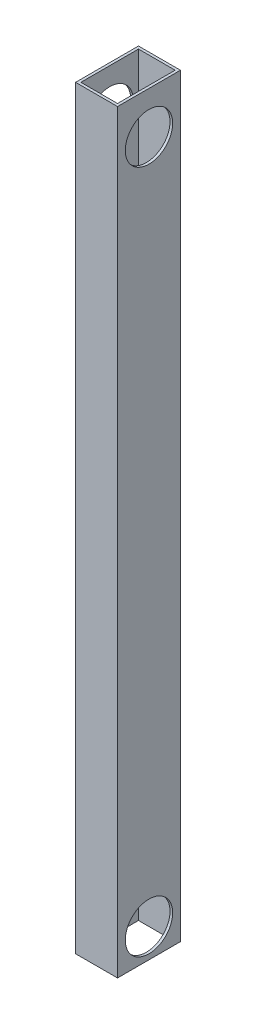
from build123d import *

# Parameters (mm, degrees)
SKETCH1_W               = 25.4
SKETCH1_H               = 38.1
SKETCH1_W_2             = 22.225
SKETCH1_H_2             = 34.925
EXTRUDE_THIN1_DEPTH     = 457.2
CUT_EXTRUDE1_DEPTH      = 460.487333884
CUT_EXTRUDE1_DEPTH_BACK = 460.487333884
SKETCH2_R               = 14.351


with BuildPart() as part:
    # Sketch1 → Extrude-Thin1 (new body)
    with BuildSketch(Plane(origin=(0, 0, 0), x_dir=(1, 0, 0), z_dir=(0, 1, 0))):
        with Locations((12.7, 19.05)):
            Rectangle(SKETCH1_W, SKETCH1_H)
        with Locations((12.7, 19.05)):
            Rectangle(SKETCH1_W_2, SKETCH1_H_2, mode=Mode.SUBTRACT)
    extrude(amount=EXTRUDE_THIN1_DEPTH)

    # Sketch2 → Cut-Extrude1 (cut, two sides: drawn at the far end of the back side and taken through both)
    with BuildSketch(Plane(origin=(25.4, 0, 0), x_dir=(0, 0, -1), z_dir=(1, 0, 0)).offset(-CUT_EXTRUDE1_DEPTH_BACK)):
        with Locations((19.05, 17.526)):
            Circle(SKETCH2_R)
        with Locations((19.05, 431.8)):
            Circle(SKETCH2_R)
    extrude(amount=CUT_EXTRUDE1_DEPTH + CUT_EXTRUDE1_DEPTH_BACK, mode=Mode.SUBTRACT)


solid = part.part
